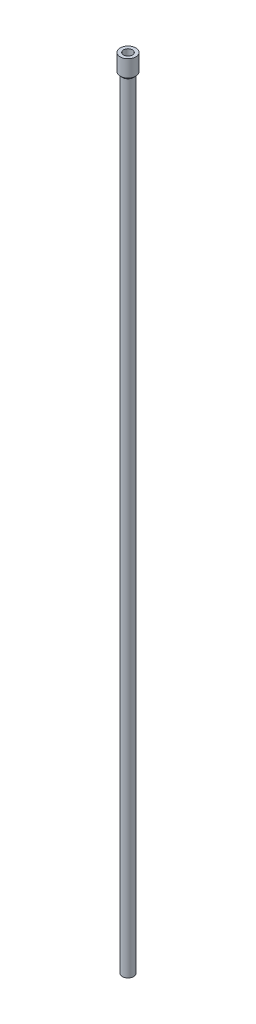
from build123d import *

# Parameters (mm, degrees)
SKETCH1_R           = 7
SKETCH1_R_2         = 4
BOSS_EXTRUDE1_DEPTH = 15
SKETCH2_R           = 5
BOSS_EXTRUDE2_DEPTH = 700
CHAMFER1_SIZE       = 2


with BuildPart() as part:
    # Sketch1 → Boss-Extrude1 (new body)
    with BuildSketch(Plane(origin=(0, 0, 0), x_dir=(1, 0, 0), z_dir=(0, 1, 0))):
        with Locations(Location((0, 0, 0), (0, 0, 270))):
            Circle(SKETCH1_R)
        with Locations(Location((0, 0, 0), (0, 0, 270))):
            Circle(SKETCH1_R_2, mode=Mode.SUBTRACT)
    extrude(amount=BOSS_EXTRUDE1_DEPTH)

    # Sketch2 → Boss-Extrude2 (add)
    with BuildSketch(Plane.XZ):
        with Locations(Location((0, 0, 0), (0, 0, 90))):
            Circle(SKETCH2_R)
    extrude(amount=BOSS_EXTRUDE2_DEPTH)

    # Chamfer1
    chamfer1_edges = [part.edges().sort_by_distance(p)[0] for p in [
        (0, 0, -5),
    ]]
    chamfer(chamfer1_edges, length=CHAMFER1_SIZE - 0.0001)  # a hair under: the kernel refuses the full size


solid = part.part
